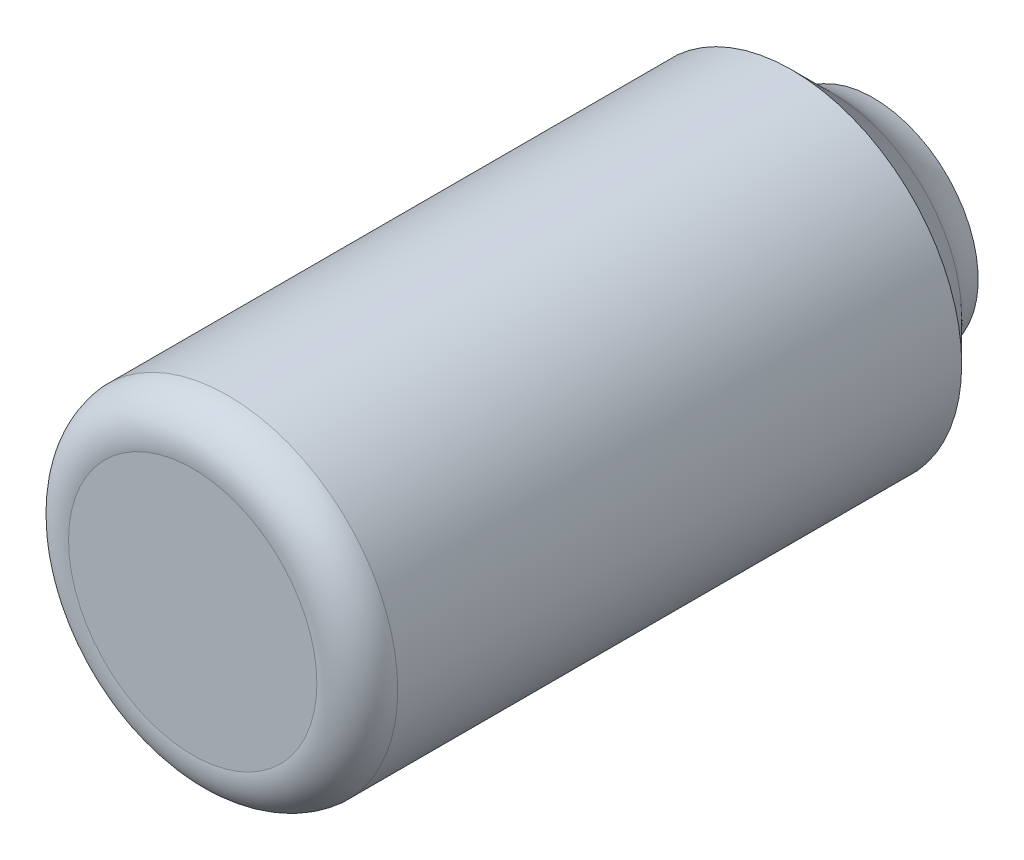
from build123d import *

# Parameters (mm, degrees)
FILLET1_R           = 10
SKETCH3_R           = 10.606635926
CUT_EXTRUDE1_DEPTH  = 1
FILLET2_R           = 1
BOSS_EXTRUDE1_DEPTH = 1
SKETCH5_R           = 1.357466481
CUT_EXTRUDE2_DEPTH  = 1


# Some blends are built 0.0001 mm under size
with BuildPart() as part:
    # Sketch2 → Revolve1 (revolve)
    with BuildSketch(Plane(origin=(0, 0, 0), x_dir=(1, 0, 0), z_dir=(0, 1, 0))):
        with BuildLine():
            Line((47.835513338, 141.44915936), (36.680360926, 141.44915936))
            Line((36.680360926, 141.44915936), (36.680360926, 139.695253367))
            Line((36.680360926, 139.695253367), (29.754604349, 132.769496791))
            Line((29.754604349, 132.769496791), (29.754604349, 72.768696414))
            ThreePointArc((29.754604349, 72.768696414), (31.416045745, 69.893157133), (34.624175548, 69.034660285))
            Line((34.624175548, 69.034660285), (47.835513338, 69.034660285))
            Line((47.835513338, 69.034660285), (47.835513338, 141.44915936))
        make_face()
    revolve(axis=Axis((47.835513338, 0, -141.44915936), (0, 0, 1)))

    # Fillet1
    # the kernel refuses this fillet: 10 mm, written as the material it adds along each edge
    with BuildSketch(Plane(origin=(47.835513338, 0, -139.695253367), x_dir=(-1, 0, 0), z_dir=(0, 1, 0))) as fillet1_piece_1:
        with BuildLine():
            CenterArc((20.759977074, -4.537310962), FILLET1_R, 135, 28.838814676)
            Line((13.688909262, 2.533756849), (13.547487906, 2.675178206))
            Line((13.547487906, 2.675178206), (11.013731056, 0.141421356))
            Line((11.013731056, 0.141421356), (10.955152412, 0))
            ThreePointArc((10.955152412, 0), (10.955152412, -0.876952996), (10.963055919, -1.698237893))
            Line((10.963055919, -1.698237893), (11.155152412, -1.753905993))
        make_face()
    revolve(axis=Axis((47.835513338, 0, -139.695253367), (0, 0, 1)))

    # Sketch3 → Cut-Extrude1 (cut)
    with BuildSketch(Plane(origin=(0, 0, -141.44915936), x_dir=(-1, 0, 0), z_dir=(0, 0, -1))):
        with Locations((-47.835513338, 0)):
            Circle(SKETCH3_R)
    extrude(amount=-CUT_EXTRUDE1_DEPTH, mode=Mode.SUBTRACT)

    # Fillet2
    fillet2_edges = [part.edges().sort_by_distance(p)[0] for p in [
        (58.442149264, 0, -140.44915936),
    ]]
    fillet(fillet2_edges, radius=FILLET2_R - 0.0001)  # a hair under: the kernel refuses the full size

    # Sketch4 → Boss-Extrude1 (add)
    with BuildSketch(Plane(origin=(0, 0, -140.44915936), x_dir=(-1, 0, 0), z_dir=(0, 0, -1))):
        Polygon((-53.244860259, -2.527826931), (-53.930670857, -1.191951097), (-53.930670857, 0), (-53.39712733, 0.986747489), (-52.726937837, 0.986747489), (-52.00416544, 0.986747489), (-51.028572962, 1.090883539), (-49.975577249, 1.090883539), (-48.95869179, 1.090883539), (-48.872046113, 1.251128017), (-47.819832156, 1.251128017), (-47.746875393, 1.211679618), (-47.373781513, 0.484938009), (-47.166149857, -0.344127446), (-47.166149857, -1.087168011), (-47.560328453, -1.81617084), (-47.945127508, -2.527826931), (-48.375815512, -2.527826931), (-49.1103871, -2.527826931), (-49.975577249, -2.527826931), (-50.676613698, -2.703394925), (-51.754528733, -2.703394925), (-52.341537829, -2.85040584), align=None)
    extrude(amount=BOSS_EXTRUDE1_DEPTH)

    # Sketch5 → Cut-Extrude2 (cut)
    with BuildSketch(Plane(origin=(0, 0, -141.44915936), x_dir=(-1, 0, 0), z_dir=(0, 0, -1))):
        with Locations((-51.615276347, -0.969807614)):
            Circle(SKETCH5_R)
    extrude(amount=-CUT_EXTRUDE2_DEPTH, mode=Mode.SUBTRACT)


solid = part.part
